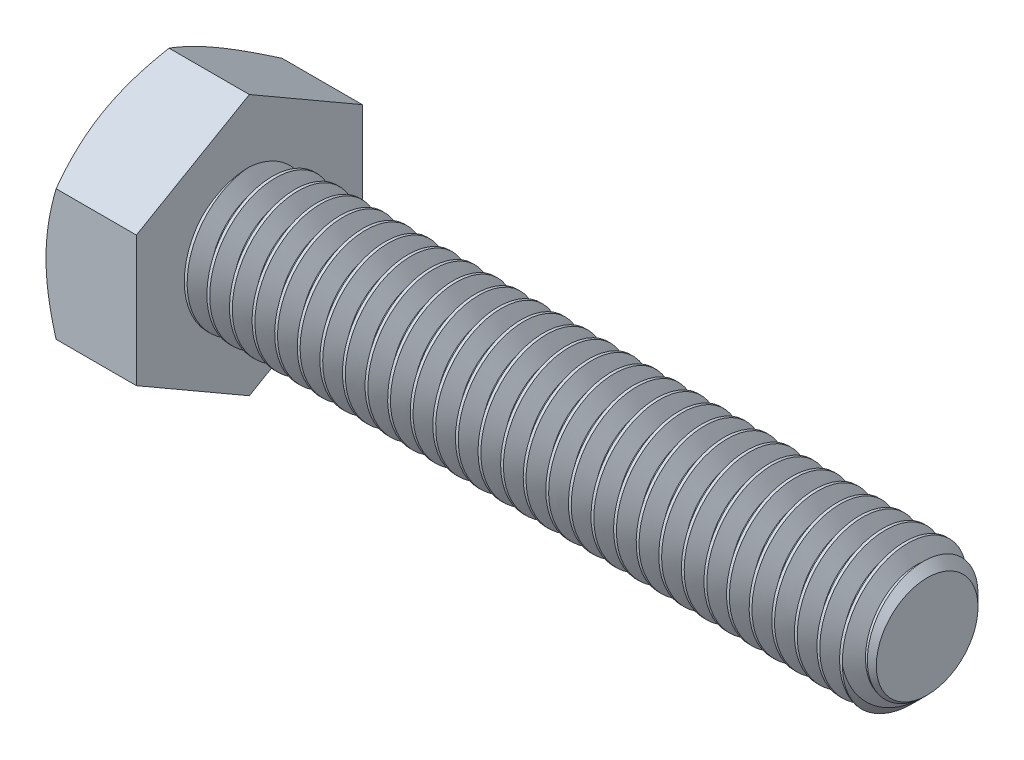
from build123d import *

# Parameters (mm, degrees)
SKETCH2_R           = 3
BOSS_EXTRUDE1_DEPTH = 30
CHAMFER1_SIZE       = 0.75
CUT_SWEEP1_PITCH    = 1
BOSS_EXTRUDE2_DEPTH = 4
SKETCH6_OUTSIDE_W   = 143.634
SKETCH6_OUTSIDE_H   = 145.182
SKETCH6_OUTSIDE_R   = 5
CUT_EXTRUDE1_DEPTH  = 35.84728601
CUT_EXTRUDE1_DRAFT  = -60
SKETCH7_W           = 0.197562976
SKETCH7_H           = 0.197562976
CUT_EXTRUDE2_DEPTH  = 0.25


with BuildPart() as part:
    # Sketch2 → Boss-Extrude1 (new body)
    with BuildSketch(Plane(origin=(17, 0, 0), x_dir=(0, 0, -1), z_dir=(1, 0, 0))):
        Circle(SKETCH2_R)
    extrude(amount=-BOSS_EXTRUDE1_DEPTH)

    # Chamfer1
    chamfer1_edges = [part.edges().sort_by_distance(p)[0] for p in [
        (17, 0, 3),
    ]]
    chamfer(chamfer1_edges, length=CHAMFER1_SIZE)

    # Cut-Sweep1: arcs per turn and ends read off the stored shape
    # Cut-Sweep1: the profile of Sketch5 profile screwed along a right-hand helix through 31 turns, 8 arcs to a turn; built about Z, then put on its axis
    cut_sweep1_z = Axis((0, 0, 0), (0, 0, 1))
    cut_sweep1_corners = [(3.0003, 0, 0.000173205), (2.350480947, 0, -0.375), (2.350480947, 0, -0.5), (3.0003, 0, -0.875173205)]
    with BuildLine(mode=Mode.PRIVATE) as cut_sweep1_profile:
        Line(cut_sweep1_corners[0], cut_sweep1_corners[1])
        Line(cut_sweep1_corners[1], cut_sweep1_corners[2])
        Line(cut_sweep1_corners[2], cut_sweep1_corners[3])
        Line(cut_sweep1_corners[3], cut_sweep1_corners[0])
    cut_sweep1_cap = Face(cut_sweep1_profile.wire())
    cut_sweep1_turn_angles = [0, 22.5, 45, 67.5, 90, 112.5, 135, 157.5, 180, 202.5, 225, 247.5, 270, 292.5, 315, 337.5, 360]
    cut_sweep1_turn_weights = [1, 0.9238795325112867, 1, 0.9238795325112867, 1, 0.9238795325112867, 1, 0.9238795325112867, 1, 0.9238795325112867, 1, 0.9238795325112867, 1, 0.9238795325112867, 1, 0.9238795325112867, 1]
    cut_sweep1_turn_rails = [Edge.make_bspline([Vector(p[0], p[1], 0).rotate(cut_sweep1_z, cut_sweep1_turn_angles[k]) / cut_sweep1_turn_weights[k] + Vector(0, 0, p[2] + CUT_SWEEP1_PITCH * cut_sweep1_turn_angles[k] / 360) for k in range(17)], [0, 0, 0, 1, 1, 2, 2, 3, 3, 4, 4, 5, 5, 6, 6, 7, 7, 8, 8, 8], 2, cut_sweep1_turn_weights) for p in cut_sweep1_corners]
    cut_sweep1_turn_sides = [Face.make_surface_from_curves(cut_sweep1_turn_rails[p[0]], cut_sweep1_turn_rails[p[1]]) for p in [(0, 1), (1, 2), (2, 3), (3, 0)]]
    cut_sweep1 = Plane(origin=(17, 0, 0), x_dir=(0, 1, 0), z_dir=(-1, 0, 0)) * Solid(Shell([*[p.moved(Location((0, 0, CUT_SWEEP1_PITCH * i))) for i in range(31) for p in cut_sweep1_turn_sides], cut_sweep1_cap, cut_sweep1_cap.rotate(cut_sweep1_z, 11160).moved(Location((0, 0, CUT_SWEEP1_PITCH * 11160 / 360)))]))
    add(cut_sweep1, mode=Mode.SUBTRACT)

    # Sketch3 → Boss-Extrude2 (add)
    with BuildSketch(Plane.ZY.offset(13)):
        Polygon((-5, -2.886751346), (0, -5.773502692), (5, -2.886751346), (5, 2.886751346), (0, 5.773502692), (-5, 2.886751346), align=None)
    extrude(amount=BOSS_EXTRUDE2_DEPTH)


with BuildPart() as cut_extrude1_tool:
    # Sketch6 outside → Cut-Extrude1 (with draft: the straight prism first)
    with BuildSketch(Plane.ZY.offset(17)):
        Rectangle(SKETCH6_OUTSIDE_W, SKETCH6_OUTSIDE_H)
        Circle(SKETCH6_OUTSIDE_R, mode=Mode.SUBTRACT)
    extrude(amount=-CUT_EXTRUDE1_DEPTH)
    # Cut-Extrude1: the draft: its side faces are tilted about the plane it starts from
    cut_extrude1_sides = [cut_extrude1_tool.faces().sort_by_distance(p)[0] for p in [
        (0.923643005, -72.591, 0),
        (0.923643005, 0, 71.817),
        (0.923643005, 72.591, 0),
        (0.923643005, 0, -71.817),
        (0.923643005, 0, -5),
    ]]
    draft(cut_extrude1_sides, Plane.ZY.offset(17), CUT_EXTRUDE1_DRAFT)


with BuildPart() as part_1:
    add(part.part)

    # Cut-Extrude1: cut by cut_extrude1_tool
    add(cut_extrude1_tool.part, mode=Mode.SUBTRACT)

    # Sketch7 → Cut-Extrude2 (cut)
    # profile 1 of 3: a face of its own
    with BuildSketch(Plane.ZY.offset(17)):
        with BuildLine():
            add(Edge.make_bspline(
                [(-1.090300672, 3.345199106), (-1.10904591, 3.352532349), (-1.144986747, 3.366592608), (-1.19346167, 3.394731144), (-1.234487944, 3.427100824), (-1.26756182, 3.464482221), (-1.292770127, 3.506102561), (-1.310921105, 3.551431184), (-1.321552451, 3.600720623), (-1.322951659, 3.634803), (-1.323671938, 3.652347795)],
                knots=[0, 0, 0, 0, 1.16287356, 2.229614231, 3.228817875, 4.173350329, 5.100165549, 6.029633206, 6.985702163, 8, 8, 8, 8], degree=3))
            add(Edge.make_bspline(
                [(-1.323671938, 3.652347795), (-1.323332936, 3.665847741), (-1.322667465, 3.692348557), (-1.316917644, 3.731234018), (-1.307708477, 3.768496018), (-1.294638515, 3.804029389), (-1.278263995, 3.838126603), (-1.257602111, 3.870162984), (-1.233852559, 3.901043945), (-1.206031088, 3.929521184), (-1.175372308, 3.955603578), (-1.142164064, 3.978814347), (-1.106152247, 3.997795114), (-1.067937276, 4.013664634), (-1.027330198, 4.026088791), (-0.984187971, 4.034550333), (-0.938662683, 4.039932502), (-0.907467674, 4.040632812), (-0.891502928, 4.040991211)],
                knots=[0, 0, 0, 0, 0.994101948, 1.951453197, 2.889123786, 3.817215529, 4.736003873, 5.669743943, 6.620499649, 7.601567446, 8.596478358, 9.582687259, 10.579761808, 11.589151689, 12.62747492, 13.702346593, 14.8241243, 16, 16, 16, 16], degree=3))
            add(Edge.make_bspline(
                [(-0.891502928, 4.040991211), (-0.875436453, 4.040629173), (-0.844140773, 4.039923964), (-0.798373618, 4.03461411), (-0.754959136, 4.025714465), (-0.713922888, 4.013088109), (-0.675200178, 3.996944553), (-0.639045453, 3.977102003), (-0.605086523, 3.953887727), (-0.574191365, 3.927024885), (-0.546080454, 3.897860574), (-0.521725005, 3.866615726), (-0.500836111, 3.834019418), (-0.483574579, 3.79987362), (-0.470804432, 3.763789502), (-0.461070714, 3.726446906), (-0.455424706, 3.68740213), (-0.454742415, 3.660906185), (-0.454394844, 3.64740872)],
                knots=[0, 0, 0, 0, 1.171211919, 2.281388661, 3.353996503, 4.398126828, 5.406889753, 6.407389155, 7.400009931, 8.40008733, 9.387021643, 10.349004252, 11.283445052, 12.206096336, 13.131640667, 14.068727932, 15.016178647, 16, 16, 16, 16], degree=3))
            add(Edge.make_bspline(
                [(-0.454394844, 3.64740872), (-0.454959462, 3.630468619), (-0.45606657, 3.597252266), (-0.467348502, 3.549370618), (-0.484932357, 3.504670699), (-0.510346333, 3.464004413), (-0.542532189, 3.426951768), (-0.58247227, 3.394741497), (-0.629560012, 3.366646938), (-0.6645934, 3.352540833), (-0.682827035, 3.345199106)],
                knots=[0, 0, 0, 0, 0.998680737, 1.958225066, 2.887911823, 3.823713378, 4.77537694, 5.772726054, 6.840782926, 8, 8, 8, 8], degree=3))
            add(Edge.make_bspline(
                [(-0.682827035, 3.345199106), (-0.671322795, 3.341293961), (-0.648779475, 3.333641573), (-0.616909948, 3.31876297), (-0.586905745, 3.302720306), (-0.558597671, 3.285354111), (-0.533030646, 3.265372905), (-0.509351678, 3.243958093), (-0.487660326, 3.220807897), (-0.468252869, 3.195725424), (-0.450925963, 3.169237111), (-0.436092756, 3.141278379), (-0.423495199, 3.112247184), (-0.412728892, 3.082008902), (-0.404864956, 3.050350539), (-0.399362666, 3.017417581), (-0.395871617, 2.983383598), (-0.395377091, 2.96026846), (-0.395125952, 2.948529693)],
                knots=[0, 0, 0, 0, 1.104208047, 2.163768705, 3.193778962, 4.198696312, 5.179575955, 6.14024585, 7.100368562, 8.060719304, 9.021161243, 9.975749006, 10.935506756, 11.897452199, 12.89163552, 13.897859372, 14.932451246, 16, 16, 16, 16], degree=3))
            add(Edge.make_bspline(
                [(-0.395125952, 2.948529693), (-0.395518566, 2.932350494), (-0.396292046, 2.900476238), (-0.403088084, 2.853688571), (-0.413370791, 2.808742632), (-0.428364165, 2.765828291), (-0.447514428, 2.724915209), (-0.471203535, 2.686062798), (-0.499198733, 2.649311024), (-0.530674211, 2.614545652), (-0.565863777, 2.58311926), (-0.603932369, 2.555425676), (-0.645022826, 2.532228768), (-0.688636579, 2.513021811), (-0.734982466, 2.498136491), (-0.784000913, 2.487713611), (-0.835675608, 2.481507244), (-0.871009164, 2.480670526), (-0.889033391, 2.480243702)],
                knots=[0, 0, 0, 0, 1.017598406, 2.004746413, 2.969099523, 3.915171376, 4.859468899, 5.806714415, 6.772805022, 7.762836953, 8.753334612, 9.736396794, 10.719437652, 11.716790048, 12.730404696, 13.776887535, 14.865953843, 16, 16, 16, 16], degree=3))
            add(Edge.make_bspline(
                [(-0.889033391, 2.480243702), (-0.907055815, 2.480679725), (-0.942385837, 2.481534475), (-0.994107744, 2.487613962), (-1.043056058, 2.498509339), (-1.089341685, 2.51340979), (-1.133215708, 2.532096716), (-1.174030202, 2.555816309), (-1.212347458, 2.583474808), (-1.247561492, 2.615095581), (-1.279298421, 2.649857245), (-1.306924581, 2.687151785), (-1.330473058, 2.726405251), (-1.349852944, 2.767838923), (-1.364624836, 2.811453179), (-1.374991925, 2.857084275), (-1.381800265, 2.904697342), (-1.382555285, 2.937186894), (-1.38294083, 2.95377746)],
                knots=[0, 0, 0, 0, 1.127066097, 2.209429196, 3.250843736, 4.258219581, 5.246860502, 6.227045772, 7.204057202, 8.19754525, 9.181483529, 10.142920909, 11.095356922, 12.039670968, 12.998174893, 13.969127444, 14.962948905, 16, 16, 16, 16], degree=3))
            add(Edge.make_bspline(
                [(-1.38294083, 2.95377746), (-1.382672847, 2.966130371), (-1.382147017, 2.99036892), (-1.378934902, 3.025920275), (-1.372533218, 3.059804454), (-1.364287442, 3.092221135), (-1.353817885, 3.123251416), (-1.340901695, 3.152651616), (-1.325231028, 3.180350678), (-1.307428123, 3.206528839), (-1.287268328, 3.231002318), (-1.265078386, 3.253556797), (-1.240777693, 3.273935731), (-1.214912328, 3.29273433), (-1.18639811, 3.308622835), (-1.156295471, 3.323203498), (-1.124086869, 3.3356381), (-1.101675528, 3.341980186), (-1.090300672, 3.345199106)],
                knots=[0, 0, 0, 0, 1.117345089, 2.192424383, 3.22371675, 4.232639188, 5.215561493, 6.182180952, 7.132172269, 8.089790513, 9.041830748, 9.996006267, 10.94686322, 11.907506267, 12.882866327, 13.894317773, 14.931262935, 16, 16, 16, 16], degree=3))
        make_face()
        with BuildLine():
            add(Edge.make_bspline(
                [(-1.126108962, 3.651421718), (-1.125522597, 3.63569432), (-1.124389481, 3.60530201), (-1.112066715, 3.56213196), (-1.092797487, 3.523353149), (-1.070207698, 3.495231653), (-1.048549764, 3.476071024), (-1.030473235, 3.463278152), (-1.010719085, 3.452417262), (-0.989144204, 3.443975494), (-0.966271136, 3.436496613), (-0.941311021, 3.432316462), (-0.914850534, 3.428918248), (-0.896557781, 3.428672138), (-0.887181238, 3.428545986)],
                knots=[0, 0, 0, 0, 1.528727296, 2.954179336, 4.335216052, 5.725683216, 6.435919001, 7.148062981, 7.879427438, 8.626027458, 9.402978632, 10.2190538, 11.08711833, 12, 12, 12, 12], degree=3))
            add(Edge.make_bspline(
                [(-0.887181238, 3.428545986), (-0.878011673, 3.428676799), (-0.860131525, 3.428931878), (-0.83426699, 3.432260813), (-0.809825095, 3.436706918), (-0.787167018, 3.443444308), (-0.766031175, 3.452204879), (-0.74676133, 3.463004501), (-0.728780836, 3.475416366), (-0.707759131, 3.494723381), (-0.685200516, 3.521859952), (-0.665866712, 3.558906458), (-0.653818708, 3.599437535), (-0.652589006, 3.627669794), (-0.65195782, 3.642160954)],
                knots=[0, 0, 0, 0, 0.922112375, 1.798068639, 2.620552757, 3.419964248, 4.17189205, 4.918165909, 5.639229138, 6.36503528, 7.785020832, 9.165298717, 10.544993853, 12, 12, 12, 12], degree=3))
            add(Edge.make_bspline(
                [(-0.65195782, 3.642160954), (-0.65271831, 3.657158684), (-0.654206393, 3.686505357), (-0.666224968, 3.72863383), (-0.68645929, 3.766789644), (-0.709574199, 3.794654295), (-0.730967776, 3.814840594), (-0.749271072, 3.827690525), (-0.768947184, 3.838626954), (-0.790070998, 3.84755802), (-0.812673062, 3.854761018), (-0.8368146, 3.859486531), (-0.862394171, 3.8628007), (-0.879966809, 3.863053896), (-0.889033391, 3.863184533)],
                knots=[0, 0, 0, 0, 1.480633456, 2.897216237, 4.289382554, 5.720567045, 6.454675042, 7.191244726, 7.924224627, 8.676083236, 9.454506446, 10.26432127, 11.104478565, 12, 12, 12, 12], degree=3))
            add(Edge.make_bspline(
                [(-0.889033391, 3.863184533), (-0.898100982, 3.863058121), (-0.915777808, 3.862811688), (-0.941524176, 3.859398068), (-0.965894504, 3.85511063), (-0.988663959, 3.848230085), (-1.009737898, 3.839238813), (-1.029336437, 3.828296242), (-1.047605053, 3.815774542), (-1.069148935, 3.796488383), (-1.091712602, 3.769351198), (-1.111590558, 3.732896368), (-1.123875778, 3.693148301), (-1.125355347, 3.665502855), (-1.126108962, 3.651421718)],
                knots=[0, 0, 0, 0, 0.914830409, 1.783417199, 2.618873138, 3.411020283, 4.179090249, 4.927874451, 5.674348476, 6.410336976, 7.841713217, 9.213201474, 10.580551314, 12, 12, 12, 12], degree=3))
        make_face(mode=Mode.SUBTRACT)
        with BuildLine():
            add(Edge.make_bspline(
                [(-1.185377855, 2.957481766), (-1.185036224, 2.944805043), (-1.184352062, 2.919418206), (-1.17835049, 2.881713372), (-1.168167066, 2.844710671), (-1.155115235, 2.808375151), (-1.136704816, 2.774173378), (-1.11229053, 2.743645779), (-1.081655173, 2.717980015), (-1.046667921, 2.696296603), (-1.008487833, 2.679229893), (-0.968703065, 2.667316749), (-0.928340442, 2.659445139), (-0.901108325, 2.658515353), (-0.88748993, 2.658050381)],
                knots=[0, 0, 0, 0, 0.957879255, 1.91828174, 2.876792425, 3.856375228, 4.831004356, 5.799187063, 6.79220414, 7.836856316, 8.902268238, 9.943090861, 10.971368942, 12, 12, 12, 12], degree=3))
            add(Edge.make_bspline(
                [(-0.88748993, 2.658050381), (-0.876260095, 2.658240606), (-0.854443727, 2.658610159), (-0.822642292, 2.662833099), (-0.792678151, 2.669240679), (-0.764414025, 2.678026522), (-0.738265928, 2.690046137), (-0.713808052, 2.704094456), (-0.691290567, 2.721072925), (-0.670719849, 2.740449644), (-0.65230541, 2.761883927), (-0.636531114, 2.785006834), (-0.62277101, 2.809168091), (-0.611536514, 2.834889135), (-0.603412162, 2.862223005), (-0.597143078, 2.890676539), (-0.593361124, 2.920543219), (-0.59291624, 2.940904396), (-0.592688927, 2.951307923)],
                knots=[0, 0, 0, 0, 1.149387474, 2.232932207, 3.278773642, 4.285224938, 5.256757121, 6.220082341, 7.168479488, 8.137608443, 9.109140627, 10.056190326, 10.999892409, 11.953252726, 12.923240661, 13.915357002, 14.934853301, 16, 16, 16, 16], degree=3))
            add(Edge.make_bspline(
                [(-0.592688927, 2.951307923), (-0.59292348, 2.961915659), (-0.593382696, 2.982683917), (-0.597068538, 3.013206109), (-0.603689152, 3.04216024), (-0.612203291, 3.069983723), (-0.623742382, 3.09619251), (-0.637593446, 3.121162402), (-0.654555372, 3.144235249), (-0.673155477, 3.166194378), (-0.694204567, 3.186072466), (-0.717449351, 3.203214091), (-0.742153148, 3.21835305), (-0.769063272, 3.22996591), (-0.797586855, 3.239268075), (-0.827859408, 3.246027169), (-0.860004362, 3.250158824), (-0.882023513, 3.250542077), (-0.893355081, 3.250739308)],
                knots=[0, 0, 0, 0, 1.065858887, 2.086781919, 3.082735321, 4.047496077, 5.006086125, 5.955204095, 6.910833714, 7.878747924, 8.844339535, 9.812198509, 10.776903849, 11.749116737, 12.749729282, 13.788304076, 14.861809717, 16, 16, 16, 16], degree=3))
            add(Edge.make_bspline(
                [(-0.893355081, 3.250739308), (-0.904378933, 3.250540114), (-0.925989116, 3.250149633), (-0.957382737, 3.245994574), (-0.987102852, 3.239613782), (-1.014887981, 3.230274644), (-1.041085524, 3.218604441), (-1.065216337, 3.203929996), (-1.087710912, 3.186897153), (-1.10788212, 3.167099713), (-1.126081777, 3.14559431), (-1.141817329, 3.122540585), (-1.155718095, 3.098473314), (-1.166267093, 3.072602762), (-1.175195875, 3.045765278), (-1.180777776, 3.017439974), (-1.18474581, 2.987948677), (-1.185164094, 2.967785837), (-1.185377855, 2.957481766)],
                knots=[0, 0, 0, 0, 1.135239447, 2.225422834, 3.256957183, 4.262780498, 5.240265059, 6.205773948, 7.16638056, 8.141101257, 9.111719309, 10.064571387, 11.014055337, 11.969087385, 12.938082716, 13.92369833, 14.938921288, 16, 16, 16, 16], degree=3))
        make_face(mode=Mode.SUBTRACT)
    # profile 2 of 3: a face of its own
    with BuildSketch(Plane.ZY.offset(17)):
        with Locations((0, 2.598781488)):
            Rectangle(SKETCH7_W, SKETCH7_H)
    # profile 3 of 3: a face of its own
    with BuildSketch(Plane.ZY.offset(17)):
        with BuildLine():
            add(Edge.make_bspline(
                [(0.687766109, 3.345199106), (0.669020872, 3.352532349), (0.633080035, 3.366592608), (0.584605112, 3.394731144), (0.543578838, 3.427100824), (0.510504961, 3.464482221), (0.485296655, 3.506102561), (0.467145677, 3.551431184), (0.456514331, 3.600720623), (0.455115123, 3.634803), (0.454394844, 3.652347795)],
                knots=[0, 0, 0, 0, 1.16287356, 2.229614231, 3.228817875, 4.173350329, 5.100165549, 6.029633206, 6.985702163, 8, 8, 8, 8], degree=3))
            add(Edge.make_bspline(
                [(0.454394844, 3.652347795), (0.454733846, 3.665847741), (0.455399317, 3.692348557), (0.461149138, 3.731234018), (0.470358305, 3.768496018), (0.483428267, 3.804029389), (0.499802787, 3.838126603), (0.520464671, 3.870162984), (0.544214223, 3.901043945), (0.572035694, 3.929521184), (0.602694474, 3.955603578), (0.635902718, 3.978814347), (0.671914535, 3.997795114), (0.710129506, 4.013664634), (0.750736584, 4.026088791), (0.793878811, 4.034550333), (0.839404099, 4.039932502), (0.870599108, 4.040632812), (0.886563854, 4.040991211)],
                knots=[0, 0, 0, 0, 0.994101948, 1.951453197, 2.889123786, 3.817215529, 4.736003873, 5.669743943, 6.620499649, 7.601567446, 8.596478358, 9.582687259, 10.579761808, 11.589151689, 12.62747492, 13.702346593, 14.8241243, 16, 16, 16, 16], degree=3))
            add(Edge.make_bspline(
                [(0.886563854, 4.040991211), (0.902630329, 4.040629173), (0.933926009, 4.039923964), (0.979693164, 4.03461411), (1.023107646, 4.025714465), (1.064143894, 4.013088109), (1.102866604, 3.996944553), (1.139021329, 3.977102003), (1.172980259, 3.953887727), (1.203875417, 3.927024885), (1.231986328, 3.897860574), (1.256341777, 3.866615726), (1.277230671, 3.834019418), (1.294492203, 3.79987362), (1.30726235, 3.763789502), (1.316996068, 3.726446906), (1.322642076, 3.68740213), (1.323324367, 3.660906185), (1.323671938, 3.64740872)],
                knots=[0, 0, 0, 0, 1.171211919, 2.281388661, 3.353996503, 4.398126828, 5.406889753, 6.407389155, 7.400009931, 8.40008733, 9.387021643, 10.349004252, 11.283445052, 12.206096336, 13.131640667, 14.068727932, 15.016178647, 16, 16, 16, 16], degree=3))
            add(Edge.make_bspline(
                [(1.323671938, 3.64740872), (1.32310732, 3.630468619), (1.322000212, 3.597252266), (1.31071828, 3.549370618), (1.293134425, 3.504670699), (1.267720449, 3.464004413), (1.235534593, 3.426951768), (1.195594512, 3.394741497), (1.148506769, 3.366646938), (1.113473382, 3.352540833), (1.095239747, 3.345199106)],
                knots=[0, 0, 0, 0, 0.998680737, 1.958225066, 2.887911823, 3.823713378, 4.77537694, 5.772726054, 6.840782926, 8, 8, 8, 8], degree=3))
            add(Edge.make_bspline(
                [(1.095239747, 3.345199106), (1.106743987, 3.341293961), (1.129287306, 3.333641573), (1.161156834, 3.31876297), (1.191161037, 3.302720306), (1.219469111, 3.285354111), (1.245036136, 3.265372905), (1.268715103, 3.243958093), (1.290406456, 3.220807897), (1.309813913, 3.195725424), (1.327140819, 3.169237111), (1.341974025, 3.141278379), (1.354571583, 3.112247184), (1.36533789, 3.082008902), (1.373201826, 3.050350539), (1.378704116, 3.017417581), (1.382195165, 2.983383598), (1.382689691, 2.96026846), (1.38294083, 2.948529693)],
                knots=[0, 0, 0, 0, 1.104208047, 2.163768705, 3.193778962, 4.198696312, 5.179575955, 6.14024585, 7.100368562, 8.060719304, 9.021161243, 9.975749006, 10.935506756, 11.897452199, 12.89163552, 13.897859372, 14.932451246, 16, 16, 16, 16], degree=3))
            add(Edge.make_bspline(
                [(1.38294083, 2.948529693), (1.382548216, 2.932350494), (1.381774736, 2.900476238), (1.374978698, 2.853688571), (1.364695991, 2.808742632), (1.349702617, 2.765828291), (1.330552354, 2.724915209), (1.306863247, 2.686062798), (1.278868049, 2.649311024), (1.247392571, 2.614545652), (1.212203005, 2.58311926), (1.174134413, 2.555425676), (1.133043956, 2.532228768), (1.089430203, 2.513021811), (1.043084316, 2.498136491), (0.994065869, 2.487713611), (0.942391174, 2.481507244), (0.907057618, 2.480670526), (0.889033391, 2.480243702)],
                knots=[0, 0, 0, 0, 1.017598406, 2.004746413, 2.969099523, 3.915171376, 4.859468899, 5.806714415, 6.772805022, 7.762836953, 8.753334612, 9.736396794, 10.719437652, 11.716790048, 12.730404696, 13.776887535, 14.865953843, 16, 16, 16, 16], degree=3))
            add(Edge.make_bspline(
                [(0.889033391, 2.480243702), (0.871010967, 2.480679725), (0.835680945, 2.481534475), (0.783959037, 2.487613962), (0.735010724, 2.498509339), (0.688725097, 2.51340979), (0.644851074, 2.532096716), (0.60403658, 2.555816309), (0.565719324, 2.583474808), (0.53050529, 2.615095581), (0.49876836, 2.649857245), (0.471142201, 2.687151785), (0.447593724, 2.726405251), (0.428213838, 2.767838923), (0.413441946, 2.811453179), (0.403074856, 2.857084275), (0.396266517, 2.904697342), (0.395511497, 2.937186894), (0.395125952, 2.95377746)],
                knots=[0, 0, 0, 0, 1.127066097, 2.209429196, 3.250843736, 4.258219581, 5.246860502, 6.227045772, 7.204057202, 8.19754525, 9.181483529, 10.142920909, 11.095356922, 12.039670968, 12.998174893, 13.969127444, 14.962948905, 16, 16, 16, 16], degree=3))
            add(Edge.make_bspline(
                [(0.395125952, 2.95377746), (0.395393935, 2.966130371), (0.395919765, 2.99036892), (0.39913188, 3.025920275), (0.405533564, 3.059804454), (0.41377934, 3.092221135), (0.424248897, 3.123251416), (0.437165087, 3.152651616), (0.452835754, 3.180350678), (0.470638659, 3.206528839), (0.490798454, 3.231002318), (0.512988396, 3.253556797), (0.537289089, 3.273935731), (0.563154454, 3.29273433), (0.591668672, 3.308622835), (0.621771311, 3.323203498), (0.653979913, 3.3356381), (0.676391254, 3.341980186), (0.687766109, 3.345199106)],
                knots=[0, 0, 0, 0, 1.117345089, 2.192424383, 3.22371675, 4.232639188, 5.215561493, 6.182180952, 7.132172269, 8.089790513, 9.041830748, 9.996006267, 10.94686322, 11.907506267, 12.882866327, 13.894317773, 14.931262935, 16, 16, 16, 16], degree=3))
        make_face()
        with BuildLine():
            add(Edge.make_bspline(
                [(0.65195782, 3.651421718), (0.652544185, 3.63569432), (0.653677301, 3.60530201), (0.666000066, 3.56213196), (0.685269295, 3.523353149), (0.707859084, 3.495231653), (0.729517018, 3.476071024), (0.747593547, 3.463278152), (0.767347697, 3.452417262), (0.788922578, 3.443975494), (0.811795646, 3.436496613), (0.83675576, 3.432316462), (0.863216248, 3.428918248), (0.881509001, 3.428672138), (0.890885544, 3.428545986)],
                knots=[0, 0, 0, 0, 1.528727296, 2.954179336, 4.335216052, 5.725683216, 6.435919001, 7.148062981, 7.879427438, 8.626027458, 9.402978632, 10.2190538, 11.08711833, 12, 12, 12, 12], degree=3))
            add(Edge.make_bspline(
                [(0.890885544, 3.428545986), (0.900055108, 3.428676799), (0.917935257, 3.428931878), (0.943799792, 3.432260813), (0.968241687, 3.436706918), (0.990899763, 3.443444308), (1.012035607, 3.452204879), (1.031305452, 3.463004501), (1.049285946, 3.475416366), (1.070307651, 3.494723381), (1.092866266, 3.521859952), (1.11220007, 3.558906458), (1.124248074, 3.599437535), (1.125477776, 3.627669794), (1.126108962, 3.642160954)],
                knots=[0, 0, 0, 0, 0.922112375, 1.798068639, 2.620552757, 3.419964248, 4.17189205, 4.918165909, 5.639229138, 6.36503528, 7.785020832, 9.165298717, 10.544993853, 12, 12, 12, 12], degree=3))
            add(Edge.make_bspline(
                [(1.126108962, 3.642160954), (1.125348471, 3.657158684), (1.123860389, 3.686505357), (1.111841814, 3.72863383), (1.091607492, 3.766789644), (1.068492583, 3.794654295), (1.047099006, 3.814840594), (1.02879571, 3.827690525), (1.009119598, 3.838626954), (0.987995784, 3.84755802), (0.96539372, 3.854761018), (0.941252181, 3.859486531), (0.915672611, 3.8628007), (0.898099973, 3.863053896), (0.889033391, 3.863184533)],
                knots=[0, 0, 0, 0, 1.480633456, 2.897216237, 4.289382554, 5.720567045, 6.454675042, 7.191244726, 7.924224627, 8.676083236, 9.454506446, 10.26432127, 11.104478565, 12, 12, 12, 12], degree=3))
            add(Edge.make_bspline(
                [(0.889033391, 3.863184533), (0.8799658, 3.863058121), (0.862288974, 3.862811688), (0.836542606, 3.859398068), (0.812172278, 3.85511063), (0.789402822, 3.848230085), (0.768328884, 3.839238813), (0.748730345, 3.828296242), (0.730461729, 3.815774542), (0.708917847, 3.796488383), (0.68635418, 3.769351198), (0.666476224, 3.732896368), (0.654191004, 3.693148301), (0.652711435, 3.665502855), (0.65195782, 3.651421718)],
                knots=[0, 0, 0, 0, 0.914830409, 1.783417199, 2.618873138, 3.411020283, 4.179090249, 4.927874451, 5.674348476, 6.410336976, 7.841713217, 9.213201474, 10.580551314, 12, 12, 12, 12], degree=3))
        make_face(mode=Mode.SUBTRACT)
        with BuildLine():
            add(Edge.make_bspline(
                [(0.592688927, 2.957481766), (0.593030558, 2.944805043), (0.59371472, 2.919418206), (0.599716292, 2.881713372), (0.609899716, 2.844710671), (0.622951547, 2.808375151), (0.641361966, 2.774173378), (0.665776252, 2.743645779), (0.696411609, 2.717980015), (0.731398861, 2.696296603), (0.769578949, 2.679229893), (0.809363717, 2.667316749), (0.84972634, 2.659445139), (0.876958457, 2.658515353), (0.890576852, 2.658050381)],
                knots=[0, 0, 0, 0, 0.957879255, 1.91828174, 2.876792425, 3.856375228, 4.831004356, 5.799187063, 6.79220414, 7.836856316, 8.902268238, 9.943090861, 10.971368942, 12, 12, 12, 12], degree=3))
            add(Edge.make_bspline(
                [(0.890576852, 2.658050381), (0.901806687, 2.658240606), (0.923623055, 2.658610159), (0.955424489, 2.662833099), (0.98538863, 2.669240679), (1.013652757, 2.678026522), (1.039800853, 2.690046137), (1.06425873, 2.704094456), (1.086776215, 2.721072925), (1.107346933, 2.740449644), (1.125761372, 2.761883927), (1.141535667, 2.785006834), (1.155295772, 2.809168091), (1.166530268, 2.834889135), (1.17465462, 2.862223005), (1.180923704, 2.890676539), (1.184705658, 2.920543219), (1.185150542, 2.940904396), (1.185377855, 2.951307923)],
                knots=[0, 0, 0, 0, 1.149387474, 2.232932207, 3.278773642, 4.285224938, 5.256757121, 6.220082341, 7.168479488, 8.137608443, 9.109140627, 10.056190326, 10.999892409, 11.953252726, 12.923240661, 13.915357002, 14.934853301, 16, 16, 16, 16], degree=3))
            add(Edge.make_bspline(
                [(1.185377855, 2.951307923), (1.185143302, 2.961915659), (1.184684086, 2.982683917), (1.180998244, 3.013206109), (1.174377629, 3.04216024), (1.165863491, 3.069983723), (1.1543244, 3.09619251), (1.140473336, 3.121162402), (1.12351141, 3.144235249), (1.104911305, 3.166194378), (1.083862215, 3.186072466), (1.060617431, 3.203214091), (1.035913634, 3.21835305), (1.00900351, 3.22996591), (0.980479927, 3.239268075), (0.950207373, 3.246027169), (0.91806242, 3.250158824), (0.896043269, 3.250542077), (0.884711701, 3.250739308)],
                knots=[0, 0, 0, 0, 1.065858887, 2.086781919, 3.082735321, 4.047496077, 5.006086125, 5.955204095, 6.910833714, 7.878747924, 8.844339535, 9.812198509, 10.776903849, 11.749116737, 12.749729282, 13.788304076, 14.861809717, 16, 16, 16, 16], degree=3))
            add(Edge.make_bspline(
                [(0.884711701, 3.250739308), (0.873687849, 3.250540114), (0.852077666, 3.250149633), (0.820684044, 3.245994574), (0.79096393, 3.239613782), (0.763178801, 3.230274644), (0.736981258, 3.218604441), (0.712850445, 3.203929996), (0.69035587, 3.186897153), (0.670184662, 3.167099713), (0.651985005, 3.14559431), (0.636249453, 3.122540585), (0.622348687, 3.098473314), (0.611799689, 3.072602762), (0.602870907, 3.045765278), (0.597289006, 3.017439974), (0.593320972, 2.987948677), (0.592902688, 2.967785837), (0.592688927, 2.957481766)],
                knots=[0, 0, 0, 0, 1.135239447, 2.225422834, 3.256957183, 4.262780498, 5.240265059, 6.205773948, 7.16638056, 8.141101257, 9.111719309, 10.064571387, 11.014055337, 11.969087385, 12.938082716, 13.92369833, 14.938921288, 16, 16, 16, 16], degree=3))
        make_face(mode=Mode.SUBTRACT)
    extrude(amount=-CUT_EXTRUDE2_DEPTH, mode=Mode.SUBTRACT)


solid = part_1.part
